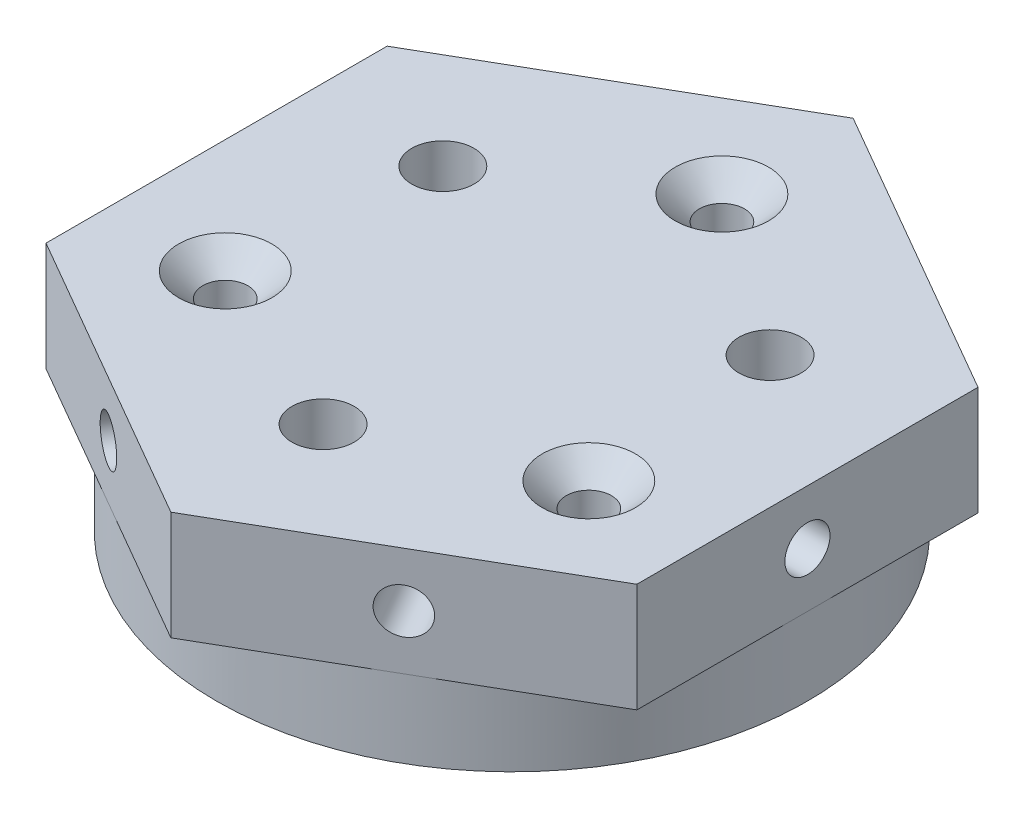
from build123d import *

# Parameters (mm, degrees)
SKETCH_1_R          = 19
SKETCH_1_R_2        = 1.45
SKETCH_1_R_3        = 2
EXTRUDE_1_DEPTH     = 12
EXTRUDE_START       = -7
SKETCH_2_R          = 1.45
SKETCH_2_R_2        = 2
EXTRUDE_2_DEPTH     = 7
SKETCH_3_R          = 1.45
CUT_EXTRUDE_1_DEPTH = 8
SKETCH_4_R          = 1.45
CUT_EXTRUDE_2_DEPTH = 8
SKETCH_5_R          = 1.45
CUT_EXTRUDE_3_DEPTH = 8
CUT_EXTRUDE_START   = -8
SKETCH_6_R          = 1.45
CUT_EXTRUDE_4_DEPTH = 8
SKETCH_7_R          = 1.45
CUT_EXTRUDE_5_DEPTH = 8
CHAMFER_1_SIZE      = 1.55


with BuildPart() as part:
    # 草图1 → 凸台-拉伸1 (new body)
    with BuildSketch(Plane(origin=(0, 0, 0), x_dir=(1, 0, 0), z_dir=(0, 1, 0))):
        Circle(SKETCH_1_R)
        with Locations((0, 13.5)):
            Circle(SKETCH_1_R_2, mode=Mode.SUBTRACT)
        with Locations((-11.691342951, -6.75)):
            Circle(SKETCH_1_R_2, mode=Mode.SUBTRACT)
        with Locations((11.691342951, -6.75)):
            Circle(SKETCH_1_R_2, mode=Mode.SUBTRACT)
        with Locations((-10.522208656, 6.075)):
            Circle(SKETCH_1_R_3, mode=Mode.SUBTRACT)
        with Locations((0, -12.15)):
            Circle(SKETCH_1_R_3, mode=Mode.SUBTRACT)
        with Locations((10.522208656, 6.075)):
            Circle(SKETCH_1_R_3, mode=Mode.SUBTRACT)
    extrude(amount=EXTRUDE_1_DEPTH)

    # 草图2 → 凸台-拉伸2 (add)
    with BuildSketch(Plane(origin=(0, 12, 0), x_dir=(1, 0, 0), z_dir=(0, 1, 0)).offset(EXTRUDE_START)):
        Polygon((0, 21.939310229), (-19, 10.969655115), (-19, -10.969655115), (0, -21.939310229), (19, -10.969655115), (19, 10.969655115), align=None)
        with Locations((0, 13.5)):
            Circle(SKETCH_2_R, mode=Mode.SUBTRACT)
        with Locations((-10.522208656, 6.075)):
            Circle(SKETCH_2_R_2, mode=Mode.SUBTRACT)
        with Locations((10.522208656, 6.075)):
            Circle(SKETCH_2_R_2, mode=Mode.SUBTRACT)
        with Locations((-11.691342951, -6.75)):
            Circle(SKETCH_2_R, mode=Mode.SUBTRACT)
        with Locations((0, -12.15)):
            Circle(SKETCH_2_R_2, mode=Mode.SUBTRACT)
        with Locations((11.691342951, -6.75)):
            Circle(SKETCH_2_R, mode=Mode.SUBTRACT)
    extrude(amount=EXTRUDE_2_DEPTH)

    # 草图3 → 切除-拉伸1 (cut)
    with BuildSketch(Plane(origin=(9.5, 0, 16.454482672), x_dir=(0.8660254037844384, 0, -0.5000000000000004), z_dir=(0.5000000000000004, 0, 0.8660254037844384))):
        with Locations((0, 8.5)):
            Circle(SKETCH_3_R)
    extrude(amount=-CUT_EXTRUDE_1_DEPTH, mode=Mode.SUBTRACT)

    # 草图4 → 切除-拉伸2 (cut)
    with BuildSketch(Plane(origin=(-9.5, 0, 16.454482672), x_dir=(0.8660254037844385, 0, 0.5000000000000004), z_dir=(-0.5000000000000003, 0, 0.8660254037844384))):
        with Locations((0, 8.5)):
            Circle(SKETCH_4_R)
    extrude(amount=-CUT_EXTRUDE_2_DEPTH, mode=Mode.SUBTRACT)

    # 草图5 → 切除-拉伸3 (cut)
    with BuildSketch(Plane.ZY.offset(19)):
        with Locations((0, 8.5)):
            Circle(SKETCH_5_R)
    extrude(amount=-CUT_EXTRUDE_3_DEPTH, mode=Mode.SUBTRACT)

    # 草图6 → 切除-拉伸4 (cut)
    with BuildSketch(Plane(origin=(19, 0, 0), x_dir=(0, 0, -1), z_dir=(1, 0, 0)).offset(CUT_EXTRUDE_START)):
        with Locations((0, 8.5)):
            Circle(SKETCH_6_R)
    extrude(amount=CUT_EXTRUDE_4_DEPTH, mode=Mode.SUBTRACT)

    # 草图7 → 切除-拉伸5 (cut)
    with BuildSketch(Plane(origin=(9.5, 0, -16.454482672), x_dir=(-0.8660254037844387, 0, -0.49999999999999994), z_dir=(0.4999999999999999, 0, -0.8660254037844386)).offset(CUT_EXTRUDE_START)):
        with Locations((0, 8.5)):
            Circle(SKETCH_7_R)
    extrude(amount=CUT_EXTRUDE_5_DEPTH, mode=Mode.SUBTRACT)

    # 倒角1
    chamfer_1_edges = [part.edges().sort_by_distance(p)[0] for p in [
        (-1.45, 12, -13.5),
        (-13.141342951, 12, 6.75),
        (10.241342951, 12, 6.75),
    ]]
    chamfer(chamfer_1_edges, length=CHAMFER_1_SIZE)


solid = part.part
